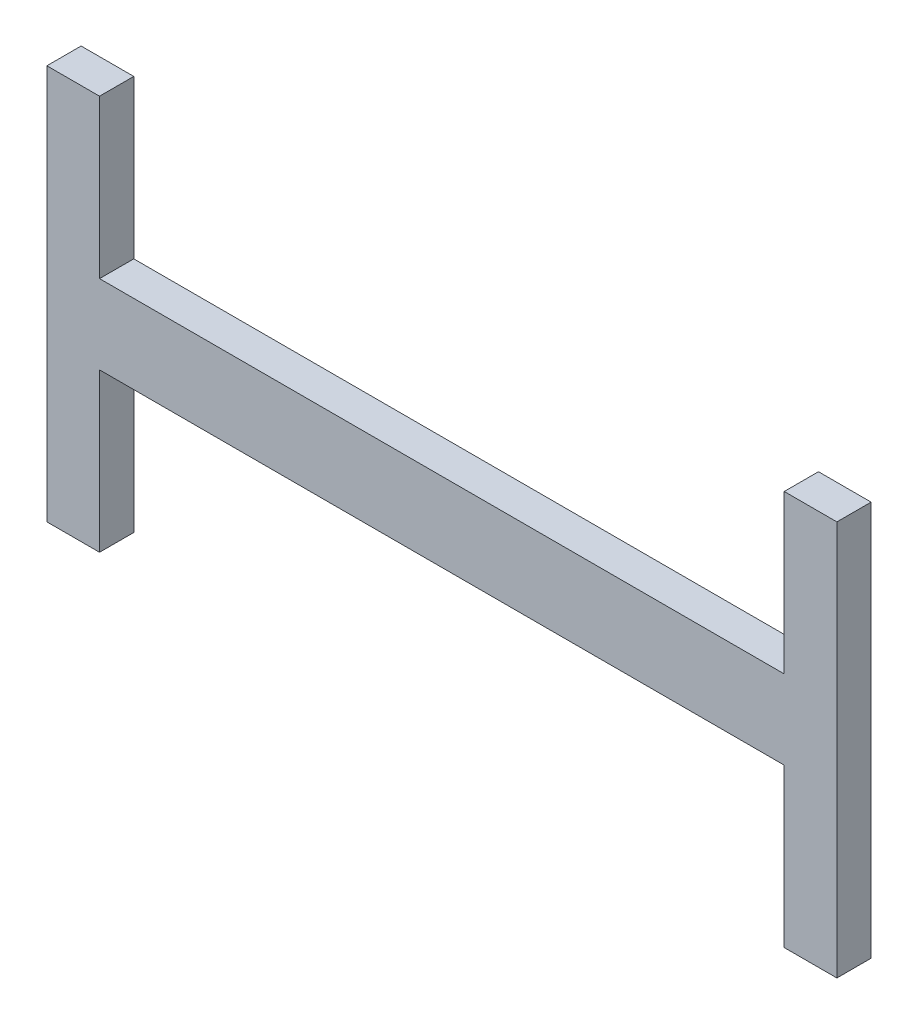
from build123d import *

# Parameters (mm, degrees)
ESQUISSE1_W             = 3000
ESQUISSE1_H             = 1500
BOSS_EXTRU_1_DEPTH      = 130
ESQUISSE3_W             = 2600
ESQUISSE3_H             = 600
ENL_V_MAT_EXTRU_1_DEPTH = 130


with BuildPart() as part:
    # Esquisse1 → Boss.-Extru.1 (new body)
    with BuildSketch(Plane.XY):
        with Locations((1500, 750)):
            Rectangle(ESQUISSE1_W, ESQUISSE1_H)
    extrude(amount=-BOSS_EXTRU_1_DEPTH)

    # Esquisse3 → Enlèv. mat.-Extru.1 (cut)
    with BuildSketch(Plane.XY):
        with Locations((1500, 1200)):
            Rectangle(ESQUISSE3_W, ESQUISSE3_H)
        with Locations((1500, 300)):
            Rectangle(ESQUISSE3_W, ESQUISSE3_H)
    extrude(amount=-ENL_V_MAT_EXTRU_1_DEPTH, mode=Mode.SUBTRACT)


solid = part.part
